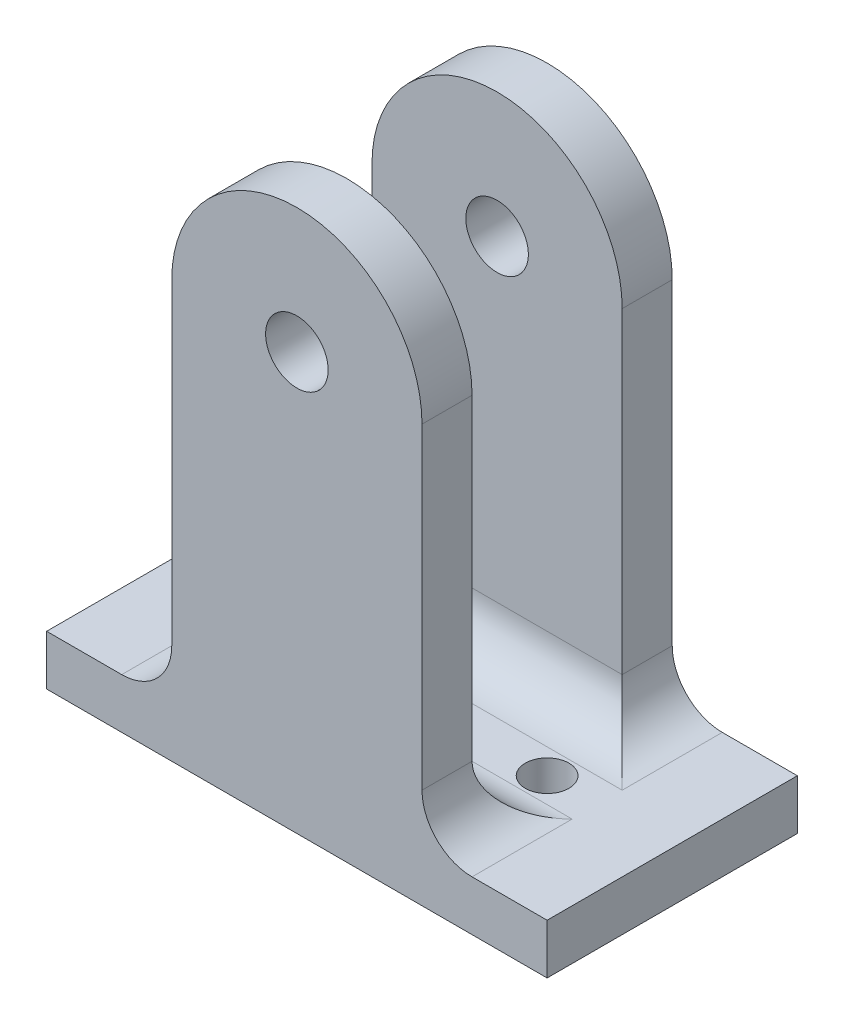
from build123d import *

# Parameters (mm, degrees)
SKETCH1_W            = 76.2
SKETCH1_H            = 38.1
SKETCH1_R            = 3.3274
BOSS_EXTRUDE1_DEPTH  = 7.62
SKETCH2_R            = 4.7625
BOSS_EXTRUDE2_DEPTH  = 7.62
FILLET1_R            = 7.62
FILLET1_OF_MIRROR2_R = 7.62


with BuildPart() as part:
    # Sketch1 → Boss-Extrude1 (new body)
    with BuildSketch(Plane(origin=(0, 0, 0), x_dir=(1, 0, 0), z_dir=(0, 1, 0))):
        with Locations((38.1, 19.05)):
            Rectangle(SKETCH1_W, SKETCH1_H)
        with Locations((19.05, 19.05)):
            Circle(SKETCH1_R, mode=Mode.SUBTRACT)
        with Locations((57.15, 19.05)):
            Circle(SKETCH1_R, mode=Mode.SUBTRACT)
    extrude(amount=BOSS_EXTRUDE1_DEPTH)

    # Sketch2 → Boss-Extrude2 (add)
    with BuildSketch(Plane.XY):
        with BuildLine():
            Line((19.05, 0), (19.05, 63.5))
            ThreePointArc((19.05, 63.5), (38.1, 82.55), (57.15, 63.5))
            Line((57.15, 63.5), (57.15, 0))
            Line((57.15, 0), (19.05, 0))
        make_face()
        with Locations((38.1, 63.5)):
            Circle(SKETCH2_R, mode=Mode.SUBTRACT)
    boss_extrude2 = extrude(amount=-BOSS_EXTRUDE2_DEPTH)

    # Fillet1
    fillet1_edges = [part.edges().sort_by_distance(p)[0] for p in [
        (38.1, 7.62, -7.62),
        (19.05, 7.62, -3.81),
        (57.15, 7.62, -3.81),
    ]]
    fillet(fillet1_edges, radius=FILLET1_R)

    # Mirror2: Boss-Extrude2 across plane
    add(boss_extrude2.mirror(Plane.XY.offset(-19.05)))

    # Fillet1 of Mirror2
    fillet1_of_mirror2_edges = [part.edges().sort_by_distance(p)[0] for p in [
        (38.1, 7.62, -30.48),
        (19.05, 7.62, -34.29),
        (57.15, 7.62, -34.29),
    ]]
    fillet(fillet1_of_mirror2_edges, radius=FILLET1_OF_MIRROR2_R)


solid = part.part
